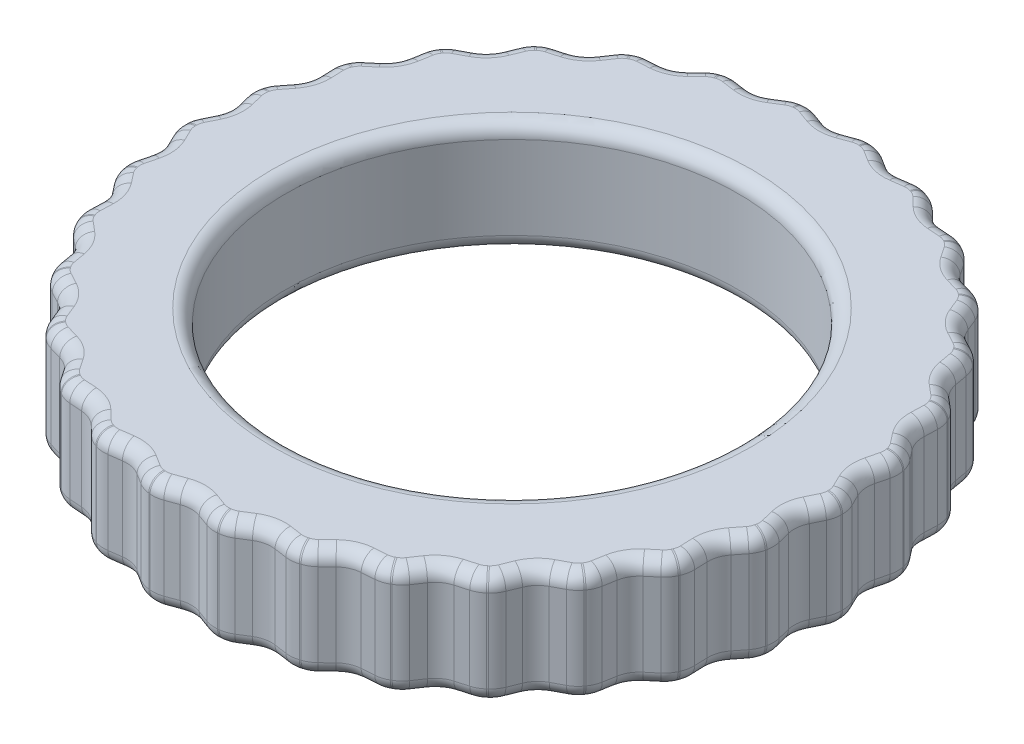
from build123d import *

# Parameters (mm, degrees)
SKETCH1_R                = 23.825
SKETCH1_R_2              = 16.325
BOSS_EXTRUDE1_DEPTH      = 8
CUT_EXTRUDE2_DEPTH       = 8
FILLET2_R                = 2
CIRPATTERN1_COUNT        = 30
FILLET2_OF_CIRPATTERN1_R = 2
FILLET1_R                = 1


with BuildPart() as part:
    # Sketch1 → Boss-Extrude1 (new body)
    with BuildSketch(Plane(origin=(0, 0, 0), x_dir=(1, 0, 0), z_dir=(0, 1, 0))):
        Circle(SKETCH1_R)
        Circle(SKETCH1_R_2, mode=Mode.SUBTRACT)
    extrude(amount=BOSS_EXTRUDE1_DEPTH)

    # Sketch2 → Cut-Extrude2 (cut)
    with BuildSketch(Plane(origin=(0, 0, 0), x_dir=(1, 0, 0), z_dir=(0, 1, 0))):
        Polygon((0, -23.025), (-4.481528392, -24.656142939), (4.481528392, -24.656142939), align=None)
    cut_extrude2 = extrude(amount=CUT_EXTRUDE2_DEPTH, mode=Mode.SUBTRACT)

    # Fillet2
    fillet2_edges = [part.edges().sort_by_distance(p)[0] for p in [
        (-1.973116259, 4, 23.743155587),
        (1.973116259, 4, 23.743155587),
        (0, 4, 23.025),
    ]]
    fillet(fillet2_edges, radius=FILLET2_R)

    # CirPattern1: Cut-Extrude2 ×30 about axis
    cirpattern1_axis = Axis((0, 8, 0), (0, 1, 0))
    for i in range(1, CIRPATTERN1_COUNT):
        add(cut_extrude2.rotate(cirpattern1_axis, i * 360 / CIRPATTERN1_COUNT), mode=Mode.SUBTRACT)

    # Fillet2 of CirPattern1
    fillet2_of_cirpattern1_edges = [part.edges().sort_by_distance(p)[0] for p in [
        (3.006480689, 4, 23.634544609),
        (6.866478558, 4, 22.814076734),
        (4.787166681, 4, 22.521848507),
        (7.854680004, 4, 22.49299062),
        (11.459742795, 4, 20.887913253),
        (9.365111207, 4, 21.034384162),
        (12.359592112, 4, 20.368385008),
        (15.552161282, 4, 18.048847732),
        (13.533755434, 4, 18.627616295),
        (16.324330736, 4, 17.353583233),
        (18.964875694, 4, 14.420960957),
        (17.110909607, 4, 15.406732211),
        (19.575617775, 4, 13.580346598),
        (21.548734034, 4, 10.162808989),
        (19.940234922, 4, 11.5125),
        (21.971356383, 4, 9.213583652),
        (23.190809294, 4, 5.460493501),
        (21.898076288, 4, 7.115116295),
        (23.406841286, 4, 4.444142888),
        (23.819334907, 4, 0.519528245),
        (22.898866641, 4, 2.406767867),
        (23.819334907, 4, -0.519528245),
        (23.406841286, 4, -4.444142888),
        (22.898866641, 4, -2.406767867),
        (23.190809294, 4, -5.460493501),
        (21.971356383, 4, -9.213583652),
        (21.898076288, 4, -7.115116295),
        (21.548734034, 4, -10.162808989),
        (19.575617775, 4, -13.580346598),
        (19.940234922, 4, -11.5125),
        (18.964875694, 4, -14.420960957),
        (16.324330736, 4, -17.353583233),
        (17.110909607, 4, -15.406732211),
        (15.552161282, 4, -18.048847732),
        (12.359592112, 4, -20.368385008),
        (13.533755434, 4, -18.627616295),
        (11.459742795, 4, -20.887913253),
        (7.854680004, 4, -22.49299062),
        (9.365111207, 4, -21.034384162),
        (6.866478558, 4, -22.814076734),
        (3.006480689, 4, -23.634544609),
        (4.787166681, 4, -22.521848507),
        (1.973116259, 4, -23.743155587),
        (-1.973116259, 4, -23.743155587),
        (0, 4, -23.025),
        (-3.006480689, 4, -23.634544609),
        (-6.866478558, 4, -22.814076734),
        (-4.787166681, 4, -22.521848507),
        (-7.854680004, 4, -22.49299062),
        (-11.459742795, 4, -20.887913253),
        (-9.365111207, 4, -21.034384162),
        (-12.359592112, 4, -20.368385008),
        (-15.552161282, 4, -18.048847732),
        (-13.533755434, 4, -18.627616295),
        (-16.324330736, 4, -17.353583233),
        (-18.964875694, 4, -14.420960957),
        (-17.110909607, 4, -15.406732211),
        (-19.575617775, 4, -13.580346598),
        (-21.548734034, 4, -10.162808989),
        (-19.940234922, 4, -11.5125),
        (-21.971356383, 4, -9.213583652),
        (-23.190809294, 4, -5.460493501),
        (-21.898076288, 4, -7.115116295),
        (-23.406841286, 4, -4.444142888),
        (-23.819334907, 4, -0.519528245),
        (-22.898866641, 4, -2.406767867),
        (-23.819334907, 4, 0.519528245),
        (-23.406841286, 4, 4.444142888),
        (-22.898866641, 4, 2.406767867),
        (-23.190809294, 4, 5.460493501),
        (-21.971356383, 4, 9.213583652),
        (-21.898076288, 4, 7.115116295),
        (-21.548734034, 4, 10.162808989),
        (-19.575617775, 4, 13.580346598),
        (-19.940234922, 4, 11.5125),
        (-18.964875694, 4, 14.420960957),
        (-16.324330736, 4, 17.353583233),
        (-17.110909607, 4, 15.406732211),
        (-15.552161282, 4, 18.048847732),
        (-12.359592112, 4, 20.368385008),
        (-13.533755434, 4, 18.627616295),
        (-11.459742795, 4, 20.887913253),
        (-7.854680004, 4, 22.49299062),
        (-9.365111207, 4, 21.034384162),
        (-6.866478558, 4, 22.814076734),
        (-3.006480689, 4, 23.634544609),
        (-4.787166681, 4, 22.521848507),
    ]]
    fillet(fillet2_of_cirpattern1_edges, radius=FILLET2_OF_CIRPATTERN1_R)

    # Fillet1
    fillet1_edges = [part.edges().sort_by_distance(p)[0] for p in [
        (8.50954223, 0, 21.860597519),
        (10.551594776, 0, 20.951417149),
        (12.868662108, 0, 19.613657701),
        (14.677061679, 0, 18.299778505),
        (16.665359701, 0, 16.509506925),
        (18.161070558, 0, 14.848351729),
        (19.733701106, 0, 12.683811474),
        (20.851353507, 0, 10.747980732),
        (21.93958508, 0, 8.303772598),
        (22.630332251, 0, 6.177871402),
        (23.186603909, 0, 3.560819014),
        (23.420256884, 0, 1.337759448),
        (23.420256884, 0, -1.337759448),
        (23.186603909, 0, -3.560819014),
        (22.630332251, 0, -6.177871402),
        (21.93958508, 0, -8.303772598),
        (20.851353507, 0, -10.747980732),
        (19.733701106, 0, -12.683811474),
        (18.161070558, 0, -14.848351729),
        (16.665359701, 0, -16.509506925),
        (14.677061679, 0, -18.299778505),
        (12.868662108, 0, -19.613657701),
        (10.551594776, 0, -20.951417149),
        (8.50954223, 0, -21.860597519),
        (5.96497255, 0, -22.687378327),
        (3.778514523, 0, -23.152124327),
        (1.1176524, 0, -23.431792206),
        (-1.1176524, 0, -23.431792206),
        (-3.778514523, 0, -23.152124327),
        (-5.96497255, 0, -22.687378327),
        (-8.50954223, 0, -21.860597519),
        (-10.551594776, 0, -20.951417149),
        (-12.868662108, 0, -19.613657701),
        (-14.677061679, 0, -18.299778505),
        (-16.665359701, 0, -16.509506925),
        (-18.161070558, 0, -14.848351729),
        (-19.733701106, 0, -12.683811474),
        (-20.851353507, 0, -10.747980732),
        (-21.93958508, 0, -8.303772598),
        (-22.630332251, 0, -6.177871402),
        (-23.186603909, 0, -3.560819014),
        (-23.420256884, 0, -1.337759448),
        (-23.420256884, 0, 1.337759448),
        (-23.186603909, 0, 3.560819014),
        (-22.630332251, 0, 6.177871402),
        (-21.93958508, 0, 8.303772598),
        (-20.851353507, 0, 10.747980732),
        (-19.733701106, 0, 12.683811474),
        (-18.161070558, 0, 14.848351729),
        (-16.665359701, 0, 16.509506925),
        (-14.677061679, 0, 18.299778505),
        (-12.868662108, 0, 19.613657701),
        (-10.551594776, 0, 20.951417149),
        (-8.50954223, 0, 21.860597519),
        (-5.96497255, 0, 22.687378327),
        (-3.778514523, 0, 23.152124327),
        (-1.1176524, 0, 23.431792206),
        (1.1176524, 0, 23.431792206),
        (3.778514523, 0, 23.152124327),
        (5.96497255, 0, 22.687378327),
        (-16.325, 0, 0),
        (1.1176524, 8, 23.431792206),
        (-1.1176524, 8, 23.431792206),
        (-3.778514523, 8, 23.152124327),
        (-5.96497255, 8, 22.687378327),
        (-8.50954223, 8, 21.860597519),
        (-10.551594776, 8, 20.951417149),
        (-12.868662108, 8, 19.613657701),
        (-14.677061679, 8, 18.299778505),
        (-16.665359701, 8, 16.509506925),
        (-18.161070558, 8, 14.848351729),
        (-19.733701106, 8, 12.683811474),
        (-20.851353507, 8, 10.747980732),
        (-21.93958508, 8, 8.303772598),
        (-22.630332251, 8, 6.177871402),
        (-23.186603909, 8, 3.560819014),
        (-23.420256884, 8, 1.337759448),
        (-23.420256884, 8, -1.337759448),
        (-23.186603909, 8, -3.560819014),
        (-22.630332251, 8, -6.177871402),
        (-21.93958508, 8, -8.303772598),
        (-20.851353507, 8, -10.747980732),
        (-19.733701106, 8, -12.683811474),
        (-18.161070558, 8, -14.848351729),
        (-16.665359701, 8, -16.509506925),
        (-14.677061679, 8, -18.299778505),
        (-12.868662108, 8, -19.613657701),
        (-10.551594776, 8, -20.951417149),
        (-8.50954223, 8, -21.860597519),
        (-5.96497255, 8, -22.687378327),
        (-3.778514523, 8, -23.152124327),
        (-1.1176524, 8, -23.431792206),
        (1.1176524, 8, -23.431792206),
        (3.778514523, 8, -23.152124327),
        (5.96497255, 8, -22.687378327),
        (8.50954223, 8, -21.860597519),
        (10.551594776, 8, -20.951417149),
        (12.868662108, 8, -19.613657701),
        (14.677061679, 8, -18.299778505),
        (16.665359701, 8, -16.509506925),
        (18.161070558, 8, -14.848351729),
        (19.733701106, 8, -12.683811474),
        (20.851353507, 8, -10.747980732),
        (21.93958508, 8, -8.303772598),
        (22.630332251, 8, -6.177871402),
        (23.186603909, 8, -3.560819014),
        (23.420256884, 8, -1.337759448),
        (23.420256884, 8, 1.337759448),
        (23.186603909, 8, 3.560819014),
        (22.630332251, 8, 6.177871402),
        (21.93958508, 8, 8.303772598),
        (20.851353507, 8, 10.747980732),
        (19.733701106, 8, 12.683811474),
        (18.161070558, 8, 14.848351729),
        (16.665359701, 8, 16.509506925),
        (14.677061679, 8, 18.299778505),
        (12.868662108, 8, 19.613657701),
        (10.551594776, 8, 20.951417149),
        (8.50954223, 8, 21.860597519),
        (5.96497255, 8, 22.687378327),
        (3.778514523, 8, 23.152124327),
        (-16.325, 8, 0),
        (-1.989461674, 0, 23.695061645),
        (0, 0, 23.153355545),
        (1.989461674, 0, 23.695061645),
        (4.813853299, 0, 22.647399175),
        (6.872467494, 0, 22.763635357),
        (9.41731811, 0, 21.151642787),
        (11.455113507, 0, 20.837328971),
        (13.60920093, 0, 18.731458113),
        (15.537116091, 0, 18.000331322),
        (17.206296366, 0, 15.492618835),
        (18.940072147, 0, 14.376632818),
        (20.051394085, 0, 11.576677772),
        (21.515256166, 0, 10.124606473),
        (22.020149665, 0, 7.15478034),
        (23.150120248, 0, 5.430086242),
        (23.026519041, 0, 2.420184675),
        (23.77321299, 0, 0.498245186),
        (23.026519041, 0, -2.420184675),
        (23.357302247, 0, -4.455371576),
        (22.020149665, 0, -7.15478034),
        (21.920565315, 0, -9.21426722),
        (20.051394085, 0, -11.576677772),
        (19.525794492, 0, -13.570455172),
        (17.206296366, 0, -15.492618835),
        (16.277652755, 0, -17.333549115),
        (13.60920093, 0, -18.731458113),
        (12.318099483, 0, -20.339083786),
        (9.41731811, 0, -21.151642787),
        (7.820186155, 0, -22.455702897),
        (4.813853299, 0, -22.647399175),
        (2.980493167, 0, -23.590900038),
        (0, 0, -23.153355545),
        (-1.989461674, 0, -23.695061645),
        (-4.813853299, 0, -22.647399175),
        (-6.872467494, 0, -22.763635357),
        (-9.41731811, 0, -21.151642787),
        (-11.455113507, 0, -20.837328971),
        (-13.60920093, 0, -18.731458113),
        (-15.537116091, 0, -18.000331322),
        (-17.206296366, 0, -15.492618835),
        (-18.940072147, 0, -14.376632818),
        (-20.051394085, 0, -11.576677772),
        (-21.515256166, 0, -10.124606473),
        (-22.020149665, 0, -7.15478034),
        (-23.150120248, 0, -5.430086242),
        (-23.026519041, 0, -2.420184675),
        (-23.77321299, 0, -0.498245186),
        (-23.026519041, 0, 2.420184675),
        (-23.357302247, 0, 4.455371576),
        (-22.020149665, 0, 7.15478034),
        (-21.920565315, 0, 9.21426722),
        (-20.051394085, 0, 11.576677772),
        (-19.525794492, 0, 13.570455172),
        (-17.206296366, 0, 15.492618835),
        (-16.277652755, 0, 17.333549115),
        (-13.60920093, 0, 18.731458113),
        (-12.318099483, 0, 20.339083786),
        (-9.41731811, 0, 21.151642787),
        (-7.820186155, 0, 22.455702897),
        (-4.813853299, 0, 22.647399175),
        (-9.41731811, 8, 21.151642787),
        (-12.318099483, 8, 20.339083786),
        (-13.60920093, 8, 18.731458113),
        (-16.277652755, 8, 17.333549115),
        (-17.206296366, 8, 15.492618835),
        (-19.525794492, 8, 13.570455172),
        (-20.051394085, 8, 11.576677772),
        (-21.920565315, 8, 9.21426722),
        (-22.020149665, 8, 7.15478034),
        (-23.357302247, 8, 4.455371576),
        (-23.026519041, 8, 2.420184675),
        (-23.77321299, 8, -0.498245186),
        (-23.026519041, 8, -2.420184675),
        (-23.150120248, 8, -5.430086242),
        (-22.020149665, 8, -7.15478034),
        (-21.515256166, 8, -10.124606473),
        (-20.051394085, 8, -11.576677772),
        (-18.940072147, 8, -14.376632818),
        (-17.206296366, 8, -15.492618835),
        (-15.537116091, 8, -18.000331322),
        (-13.60920093, 8, -18.731458113),
        (-11.455113507, 8, -20.837328971),
        (-9.41731811, 8, -21.151642787),
        (-6.872467494, 8, -22.763635357),
        (-4.813853299, 8, -22.647399175),
        (-1.989461674, 8, -23.695061645),
        (0, 8, -23.153355545),
        (2.980493167, 8, -23.590900038),
        (4.813853299, 8, -22.647399175),
        (7.820186155, 8, -22.455702897),
        (9.41731811, 8, -21.151642787),
        (12.318099483, 8, -20.339083786),
        (13.60920093, 8, -18.731458113),
        (16.277652755, 8, -17.333549115),
        (17.206296366, 8, -15.492618835),
        (19.525794492, 8, -13.570455172),
        (20.051394085, 8, -11.576677772),
        (21.920565315, 8, -9.21426722),
        (22.020149665, 8, -7.15478034),
        (23.357302247, 8, -4.455371576),
        (23.026519041, 8, -2.420184675),
        (23.77321299, 8, 0.498245186),
        (23.026519041, 8, 2.420184675),
        (23.150120248, 8, 5.430086242),
        (22.020149665, 8, 7.15478034),
        (21.515256166, 8, 10.124606473),
        (20.051394085, 8, 11.576677772),
        (18.940072147, 8, 14.376632818),
        (17.206296366, 8, 15.492618835),
        (15.537116091, 8, 18.000331322),
        (13.60920093, 8, 18.731458113),
        (11.455113507, 8, 20.837328971),
        (9.41731811, 8, 21.151642787),
        (6.872467494, 8, 22.763635357),
        (4.813853299, 8, 22.647399175),
        (1.989461674, 8, 23.695061645),
        (0, 8, 23.153355545),
        (-1.989461674, 8, 23.695061645),
        (-4.813853299, 8, 22.647399175),
        (-7.820186155, 8, 22.455702897),
        (-2.980493167, 0, 23.590900038),
        (2.980493167, 0, 23.590900038),
        (7.820186155, 0, 22.455702897),
        (12.318099483, 0, 20.339083786),
        (16.277652755, 0, 17.333549115),
        (19.525794492, 0, 13.570455172),
        (21.920565315, 0, 9.21426722),
        (23.357302247, 0, 4.455371576),
        (23.77321299, 0, -0.498245186),
        (23.150120248, 0, -5.430086242),
        (21.515256166, 0, -10.124606473),
        (18.940072147, 0, -14.376632818),
        (15.537116091, 0, -18.000331322),
        (11.455113507, 0, -20.837328971),
        (6.872467494, 0, -22.763635357),
        (1.989461674, 0, -23.695061645),
        (-2.980493167, 0, -23.590900038),
        (-7.820186155, 0, -22.455702897),
        (-12.318099483, 0, -20.339083786),
        (-16.277652755, 0, -17.333549115),
        (-19.525794492, 0, -13.570455172),
        (-21.920565315, 0, -9.21426722),
        (-23.357302247, 0, -4.455371576),
        (-23.77321299, 0, 0.498245186),
        (-23.150120248, 0, 5.430086242),
        (-21.515256166, 0, 10.124606473),
        (-18.940072147, 0, 14.376632818),
        (-15.537116091, 0, 18.000331322),
        (-11.455113507, 0, 20.837328971),
        (-6.872467494, 0, 22.763635357),
        (-11.455113507, 8, 20.837328971),
        (-15.537116091, 8, 18.000331322),
        (-18.940072147, 8, 14.376632818),
        (-21.515256166, 8, 10.124606473),
        (-23.150120248, 8, 5.430086242),
        (-23.77321299, 8, 0.498245186),
        (-23.357302247, 8, -4.455371576),
        (-21.920565315, 8, -9.21426722),
        (-19.525794492, 8, -13.570455172),
        (-16.277652755, 8, -17.333549115),
        (-12.318099483, 8, -20.339083786),
        (-7.820186155, 8, -22.455702897),
        (-2.980493167, 8, -23.590900038),
        (1.989461674, 8, -23.695061645),
        (6.872467494, 8, -22.763635357),
        (11.455113507, 8, -20.837328971),
        (15.537116091, 8, -18.000331322),
        (18.940072147, 8, -14.376632818),
        (21.515256166, 8, -10.124606473),
        (23.150120248, 8, -5.430086242),
        (23.77321299, 8, -0.498245186),
        (23.357302247, 8, 4.455371576),
        (21.920565315, 8, 9.21426722),
        (19.525794492, 8, 13.570455172),
        (16.277652755, 8, 17.333549115),
        (12.318099483, 8, 20.339083786),
        (7.820186155, 8, 22.455702897),
        (2.980493167, 8, 23.590900038),
        (-2.980493167, 8, 23.590900038),
        (-6.872467494, 8, 22.763635357),
        (-2.490390637, 0, 23.694484157),
        (2.490390637, 0, 23.694484157),
        (7.362329891, 0, 22.658921501),
        (11.9125, 0, 20.633055245),
        (15.942036696, 0, 17.705425467),
        (19.274829891, 0, 14.003983636),
        (21.765220528, 0, 9.690500521),
        (23.304366587, 0, 4.953496034),
        (23.825, 0, 0),
        (23.304366587, 0, -4.953496034),
        (21.765220528, 0, -9.690500521),
        (19.274829891, 0, -14.003983636),
        (15.942036696, 0, -17.705425467),
        (11.9125, 0, -20.633055245),
        (7.362329891, 0, -22.658921501),
        (2.490390637, 0, -23.694484157),
        (-2.490390637, 0, -23.694484157),
        (-7.362329891, 0, -22.658921501),
        (-11.9125, 0, -20.633055245),
        (-15.942036696, 0, -17.705425467),
        (-19.274829891, 0, -14.003983636),
        (-21.765220528, 0, -9.690500521),
        (-23.304366587, 0, -4.953496034),
        (-23.825, 0, 0),
        (-23.304366587, 0, 4.953496034),
        (-21.765220528, 0, 9.690500521),
        (-19.274829891, 0, 14.003983636),
        (-15.942036696, 0, 17.705425467),
        (-11.9125, 0, 20.633055245),
        (-7.362329891, 0, 22.658921501),
        (-11.9125, 8, 20.633055245),
        (-15.942036696, 8, 17.705425467),
        (-19.274829891, 8, 14.003983636),
        (-21.765220528, 8, 9.690500521),
        (-23.304366587, 8, 4.953496034),
        (-23.825, 8, 0),
        (-23.304366587, 8, -4.953496034),
        (-21.765220528, 8, -9.690500521),
    ]]
    fillet(fillet1_edges, radius=FILLET1_R)


solid = part.part
